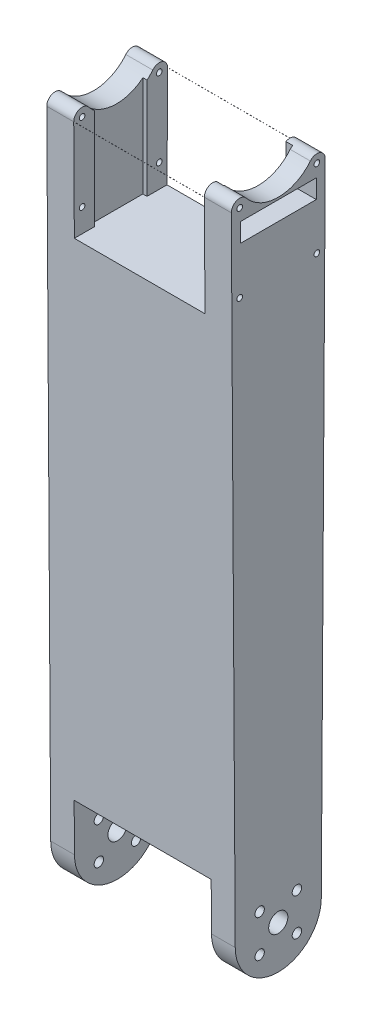
from build123d import *

# Parameters (mm, degrees)
BOSS_EXTRUDE1_DEPTH      = 24.511
BOSS_EXTRUDE1_DEPTH_BACK = 24.511
CUT_EXTRUDE3_DEPTH       = 212.61733137
CUT_EXTRUDE3_DEPTH_BACK  = 212.61733137
SKETCH3_4_R              = 1.250061
SKETCH3_4_R_2            = 0.750062
SKETCH3_4_R_3            = 2.54
CUT_EXTRUDE4_DEPTH       = 18.2000017
CUT_EXTRUDE4_DEPTH_BACK  = 18.2000017
SKETCH4_W                = 23.01416747
SKETCH4_H                = 23.93
CUT_EXTRUDE5_DEPTH       = 17.3500034
CUT_EXTRUDE5_DEPTH_BACK  = 17.3500034
SKETCH4_4_W              = 24.944915852
SKETCH4_4_H              = 29.1224716
SKETCH5_W                = 20.2
SKETCH5_H                = 5
CUT_EXTRUDE6_DEPTH       = 18.2000017
SKETCH5_3_W              = 18.4
SKETCH5_3_H              = 13.35
CUT_EXTRUDE7_DEPTH       = 1.7999964
SKETCH6_W                = 13.9999974
SKETCH6_H                = 29.1224716
CUT_EXTRUDE8_DEPTH       = 1.0999978


with BuildPart() as part:
    # Sketch3 → Boss-Extrude1 (new, two sides: drawn at the far end of the back side and taken through both)
    with BuildSketch(Plane(origin=(0, 0, 0), x_dir=(0, 0, -1), z_dir=(1, 0, 0)).offset(-BOSS_EXTRUDE1_DEPTH_BACK)):
        with BuildLine():
            Line((-11.429783892, 38.029713575), (-12.472457926, 207.586478685))
            ThreePointArc((-12.472457926, 207.586478685), (-10.998297042, 209.692884773), (-8.522757463, 208.998766114))
            ThreePointArc((-8.522757463, 208.998766114), (0, 204.933486246), (8.522757463, 208.998766114))
            ThreePointArc((8.522757463, 208.998766114), (10.998297042, 209.692884773), (12.472457926, 207.586478685))
            Line((12.472457926, 207.586478685), (11.429783892, 38.029713575))
            ThreePointArc((11.429783892, 38.029713575), (0, 26.67), (-11.429783892, 38.029713575))
        make_face()
    extrude(amount=BOSS_EXTRUDE1_DEPTH + BOSS_EXTRUDE1_DEPTH_BACK)

    # Sketch3<4> → Cut-Extrude3 (cut, two sides: drawn at the far end of the back side and taken through both)
    with BuildSketch(Plane(origin=(0, 0, 0), x_dir=(0, 0, -1), z_dir=(1, 0, 0)).offset(-CUT_EXTRUDE3_DEPTH_BACK)):
        with Locations((-4.949737569, 43.049737569)):
            Circle(SKETCH3_4_R)
        with Locations((4.949737569, 43.049737569)):
            Circle(SKETCH3_4_R)
        with Locations((4.949737569, 33.150262431)):
            Circle(SKETCH3_4_R)
        with Locations((-4.949737569, 33.150262431)):
            Circle(SKETCH3_4_R)
        with Locations((-10.249999947, 186.90016149)):
            Circle(SKETCH3_4_R_2)
        with Locations((10.249999947, 186.90016149)):
            Circle(SKETCH3_4_R_2)
        with Locations((10.249999947, 207.60014549)):
            Circle(SKETCH3_4_R_2)
        with Locations((-10.249999947, 207.60014549)):
            Circle(SKETCH3_4_R_2)
        with Locations((0, 38.1)):
            Circle(SKETCH3_4_R_3)
    extrude(amount=CUT_EXTRUDE3_DEPTH + CUT_EXTRUDE3_DEPTH_BACK, mode=Mode.SUBTRACT)

    # Sketch4 → Cut-Extrude4 (cut, two sides: drawn at the far end of the back side and taken through both)
    with BuildSketch(Plane(origin=(0, 0, 0), x_dir=(0, 0, -1), z_dir=(1, 0, 0)).offset(-CUT_EXTRUDE4_DEPTH_BACK)):
        with Locations((0, 38.635)):
            Rectangle(SKETCH4_W, SKETCH4_H)
    extrude(amount=CUT_EXTRUDE4_DEPTH + CUT_EXTRUDE4_DEPTH_BACK, mode=Mode.SUBTRACT)

    # Sketch4<4> → Cut-Extrude5 (cut, two sides: drawn at the far end of the back side and taken through both)
    with BuildSketch(Plane(origin=(0, 0, 0), x_dir=(0, 0, -1), z_dir=(1, 0, 0)).offset(-CUT_EXTRUDE5_DEPTH_BACK)):
        with Locations((0, 195.26140969)):
            Rectangle(SKETCH4_4_W, SKETCH4_4_H)
    extrude(amount=CUT_EXTRUDE5_DEPTH + CUT_EXTRUDE5_DEPTH_BACK, mode=Mode.SUBTRACT)

    # Sketch5 → Cut-Extrude6 (cut)
    with BuildSketch(Plane.ZY.offset(-17.3500034)):
        with Locations((5.3e-08, 201.85014549)):
            Rectangle(SKETCH5_W, SKETCH5_H)
    extrude(amount=-CUT_EXTRUDE6_DEPTH, mode=Mode.SUBTRACT)

    # Sketch5<3> → Cut-Extrude7 (cut)
    with BuildSketch(Plane.ZY.offset(-17.3500034)):
        with BuildLine():
            Line((-9.199999947, 209.558973264), (-9.199999947, 204.35014549))
            Line((-9.199999947, 204.35014549), (9.200000053, 204.35014549))
            Line((9.200000053, 204.35014549), (9.200000053, 209.558973321))
            ThreePointArc((9.200000053, 209.558973321), (8.833410085, 209.31268145), (8.522757463, 208.998766114))
            ThreePointArc((8.522757463, 208.998766114), (0, 204.933486246), (-8.522757463, 208.998766114))
            ThreePointArc((-8.522757463, 208.998766114), (-8.833410039, 209.312681412), (-9.199999947, 209.558973264))
        make_face()
        with Locations((5.3e-08, 192.67514549)):
            Rectangle(SKETCH5_3_W, SKETCH5_3_H)
    extrude(amount=-CUT_EXTRUDE7_DEPTH, mode=Mode.SUBTRACT)

    # Sketch6 → Cut-Extrude8 (cut)
    with BuildSketch(Plane(origin=(-17.3500034, 0, 0), x_dir=(0, 0, -1), z_dir=(1, 0, 0))):
        with Locations((0, 195.26140969)):
            Rectangle(SKETCH6_W, SKETCH6_H)
    extrude(amount=-CUT_EXTRUDE8_DEPTH, mode=Mode.SUBTRACT)


solid = part.part
